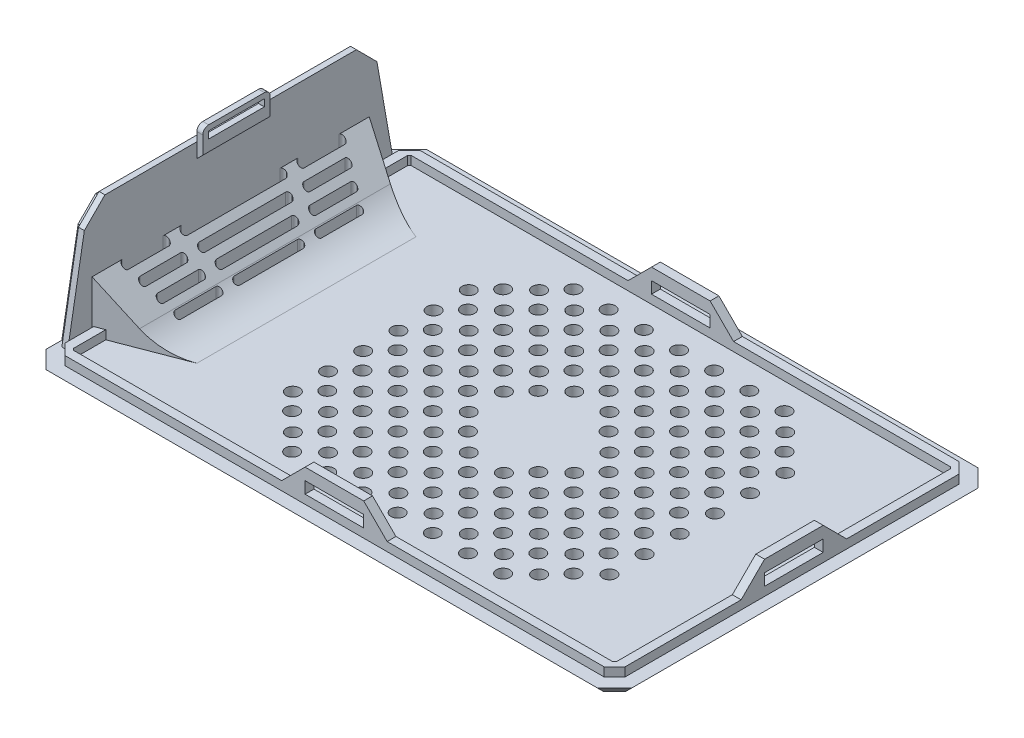
from build123d import *

# Parameters (mm, degrees)
SKETCH_1_W                = 100
SKETCH_1_H                = 65
EXTRUDE_1_DEPTH           = 2
EXTRUDE_2_DEPTH           = 2
RIB_3_REACH               = 65.494
SKETCH_7_WALL_W           = 143.931495702
SKETCH_7_WALL_H           = 40
CUT_EXTRUDE_3_DEPTH       = 18
CUT_EXTRUDE_3_DEPTH_BACK  = 18
CHAMFER_5_SIZE            = 3.646708333
CHAMFER_5_SIZE_2          = 9.5
CHAMFER_6_SIZE            = 3.646708333
CHAMFER_6_SIZE_2          = 9.5
CHAMFER_7_SIZE            = 3.83864035
CHAMFER_7_SIZE_2          = 10
CHAMFER_8_SIZE            = 3.83864035
CHAMFER_8_SIZE_2          = 10
EXTRUDE_3_DEPTH           = 1.5
SKETCH_11_W               = 1.5
SKETCH_11_H               = 10
SKETCH_11_W_2             = 10
SKETCH_11_H_2             = 1.5
EXTRUDE_4_DEPTH           = 4
CHAMFER_9_SIZE            = 4
SKETCH_12_W               = 10
SKETCH_12_H               = 2
CUT_EXTRUDE_5_DEPTH       = 84.181007448
CUT_EXTRUDE_6_REACH       = 107.339
SKETCH_13_W               = 10
SKETCH_13_H               = 2
SKETCH_14_W               = 11.5
SKETCH_14_H               = 5
EXTRUDE_5_DEPTH           = 1
CHAMFER_11_SIZE           = 1
CUT_EXTRUDE_7_REACH       = 107.146
SKETCH_15_W               = 9.5
SKETCH_15_H               = 1.2
SKETCH_16_R               = 6
EXTRUDE_6_DEPTH           = 1
CUT_EXTRUDE_11_DEPTH      = 0.5
CUT_EXTRUDE_11_DEPTH_BACK = 0.5
SKETCH_17_R               = 5
SKETCH_19_R               = 1.25
CUT_EXTRUDE_12_DEPTH      = 2
CUT_EXTRUDE_12_TAPER      = 3
CHAMFER_12_SIZE           = 3
CHAMFER_13_SIZE           = 2
FILLET_1_R                = 10
SKETCH_21_W               = 1
SKETCH_21_H               = 12
SKETCH_21_H_2             = 14
SKETCH_21_H_3             = 16
SKETCH_21_H_4             = 18
SKETCH_21_H_5             = 8
CUT_EXTRUDE_14_DEPTH      = 12
FILLET_2_R                = 0.6
FILLET_4_R                = 1
CUT_EXTRUDE_15_DEPTH      = 1
FILLET_5_R                = 0.5


# Some blends are built 0.0001 mm under size
with BuildPart() as part:
    # 草图1 → 凸台-拉伸1 (new body)
    with BuildSketch(Plane(origin=(0, 0, 0), x_dir=(1, 0, 0), z_dir=(0, 1, 0))):
        Rectangle(SKETCH_1_W, SKETCH_1_H)
    extrude(amount=EXTRUDE_1_DEPTH)

    # 草图2 → 凸台-拉伸2 (add)
    with BuildSketch(Plane.ZY.offset(50)):
        Polygon((21.45, 21.8), (24.96, 18.274540908), (27.80177009, 2), (-27.795672162, 2), (-24.960295761, 18.274540908), (-21.45, 21.8), align=None)
    extrude(amount=-EXTRUDE_2_DEPTH)

    # 草图7 wall → 筋3 (add, up to next)
    with BuildSketch(Plane(origin=(-43.769470265, 6.556687364, 0), x_dir=(0.707106781187, -0.707106781187, 0), z_dir=(0.707106781187, 0.707106781187, 0)), mode=Mode.PRIVATE) as rib_3_sk1:
        Rectangle(SKETCH_7_WALL_W, SKETCH_7_WALL_H)
    rib_3_tool1 = extrude(rib_3_sk1.sketch, amount=-RIB_3_REACH, mode=Mode.PRIVATE) - part.part
    add(rib_3_tool1.solids().sort_by_distance((-43.769470265, 6.556687364, 0))[0])

    # 草图8 → 切除-拉伸3 (cut, two sides: drawn at the far end of the back side and taken through both)
    with BuildSketch(Plane.XY.offset(-CUT_EXTRUDE_3_DEPTH_BACK)):
        Polygon((-52.858914497, 12.817704471), (-36.973570274, -3.067639752), (-52.858914497, -3.067639752), align=None)
    extrude(amount=CUT_EXTRUDE_3_DEPTH + CUT_EXTRUDE_3_DEPTH_BACK, mode=Mode.SUBTRACT)

    # 倒角5
    # the kernel refuses this chamfer: 9.5, 3.646708333 mm, written as the material it adds along each edge
    with BuildSketch(Plane(origin=(-48, 35.426470674, -20), x_dir=(0, 0, -1), z_dir=(0, -1, 0))) as chamfer_5_piece_1_section:
        Polygon((CHAMFER_5_SIZE, 0), (0, CHAMFER_5_SIZE_2), (0, 0), align=None)
    chamfer_5_piece_1 = extrude(amount=33.426470674, mode=Mode.PRIVATE)
    chamfer_5_piece_1 = split(chamfer_5_piece_1, bisect_by=Plane(origin=(-60.319626788, 23.106843887, -20), z_dir=(-0.7071067811865476, -0.7071067811865476, 0)), keep=Keep.TOP, mode=Mode.PRIVATE)
    add(chamfer_5_piece_1)

    # 倒角6
    # the kernel refuses this chamfer: 9.5, 3.646708333 mm, written as the material it adds along each edge
    with BuildSketch(Plane(origin=(-48, 2, 20), x_dir=(0, 0, 1), z_dir=(0, 1, 0))) as chamfer_6_piece_1_section:
        Polygon((CHAMFER_6_SIZE, 0), (0, CHAMFER_6_SIZE_2), (0, 0), align=None)
    chamfer_6_piece_1 = extrude(amount=33.426470674, mode=Mode.PRIVATE)
    chamfer_6_piece_1 = split(chamfer_6_piece_1, bisect_by=Plane(origin=(-43.60639145, 6.393608549, 20), z_dir=(-0.7071067811865476, -0.7071067811865476, 0)), keep=Keep.TOP, mode=Mode.PRIVATE)
    add(chamfer_6_piece_1)

    # 倒角7
    # the kernel refuses this chamfer: 10, 3.83864035 mm, written as the material it takes off along each edge
    with BuildSketch(Plane(origin=(-50, 35.894846369, 18), x_dir=(0, 0, 1), z_dir=(0, -1, 0))) as chamfer_7_piece_1_section:
        Polygon((CHAMFER_7_SIZE, 0), (0, -CHAMFER_7_SIZE_2), (0, 0), align=None)
    chamfer_7_piece_1 = extrude(amount=61.830902764, mode=Mode.PRIVATE)
    chamfer_7_piece_1 = split(chamfer_7_piece_1, bisect_by=Plane(origin=(-62.968028198, 22.926818172, 18), z_dir=(-0.7071067811865475, -0.7071067811865477, 0)), keep=Keep.TOP, mode=Mode.PRIVATE)
    add(chamfer_7_piece_1, mode=Mode.SUBTRACT)

    # 倒角8
    # the kernel refuses this chamfer: 10, 3.83864035 mm, written as the material it takes off along each edge
    with BuildSketch(Plane(origin=(-50, 35.894846369, -18), x_dir=(0, 0, -1), z_dir=(0, -1, 0))) as chamfer_8_piece_1_section:
        Polygon((CHAMFER_8_SIZE, 0), (0, CHAMFER_8_SIZE_2), (0, 0), align=None)
    chamfer_8_piece_1 = extrude(amount=61.830902764, mode=Mode.PRIVATE)
    chamfer_8_piece_1 = split(chamfer_8_piece_1, bisect_by=Plane(origin=(-62.968028198, 22.926818172, -18), z_dir=(-0.7071067811865476, -0.7071067811865476, 0)), keep=Keep.TOP, mode=Mode.PRIVATE)
    add(chamfer_8_piece_1, mode=Mode.SUBTRACT)

    # 草图10 → 凸台-拉伸3 (add)
    with BuildSketch(Plane(origin=(0, 2, 0), x_dir=(1, 0, 0), z_dir=(0, 1, 0))):
        Polygon((-46.3, -23), (-46.3, -28.5), (-46, -28.8), (46, -28.8), (46.3, -28.5), (46.3, 28.5), (46, 28.8), (-46, 28.8), (-46.3, 28.5), (-46.3, 23), (-47.8, 23), (-47.8, 28.5), (-46, 30.3), (46, 30.3), (47.8, 28.5), (47.8, -28.5), (46, -30.3), (-46, -30.3), (-47.8, -28.5), (-47.8, -23), align=None)
    extrude(amount=EXTRUDE_3_DEPTH)

    # 草图11 → 凸台-拉伸4 (add)
    with BuildSketch(Plane(origin=(0, 3.5, 0), x_dir=(1, 0, 0), z_dir=(0, 1, 0))):
        with Locations((47.05, 0.290211062)):
            Rectangle(SKETCH_11_W, SKETCH_11_H)
        with Locations((0, 29.55)):
            Rectangle(SKETCH_11_W_2, SKETCH_11_H_2)
        with Locations((0, -29.55)):
            Rectangle(SKETCH_11_W_2, SKETCH_11_H_2)
    extrude(amount=EXTRUDE_4_DEPTH)

    # 倒角9
    chamfer_9_edges = [part.edges().sort_by_distance(p)[0] for p in [
        (47.05, 3.5, -5.290211062),
        (47.05, 3.5, 4.709788938),
        (5, 3.5, 29.55),
        (-5, 3.5, 29.55),
        (-5, 3.5, -29.55),
        (5, 3.5, -29.55),
    ]]
    chamfer(chamfer_9_edges, length=CHAMFER_9_SIZE - 0.0001)  # a hair under: the kernel refuses the full size

    # 草图12 → 切除-拉伸5 (cut, through all)
    with BuildSketch(Plane.XY.offset(30.3)):
        with Locations((0, 4.5)):
            Rectangle(SKETCH_12_W, SKETCH_12_H)
    extrude(amount=-CUT_EXTRUDE_5_DEPTH, mode=Mode.SUBTRACT)

    # 草图13 → 切除-拉伸6 (cut, up to next)
    with BuildSketch(Plane(origin=(47.8, 0, 0), x_dir=(0, 0, -1), z_dir=(1, 0, 0)), mode=Mode.PRIVATE) as cut_extrude_6_sk1:
        with Locations((0.290211062, 4.5)):
            Rectangle(SKETCH_13_W, SKETCH_13_H)
    cut_extrude_6_tool1 = extrude(cut_extrude_6_sk1.sketch, amount=-CUT_EXTRUDE_6_REACH, mode=Mode.PRIVATE) & part.part
    add(cut_extrude_6_tool1.solids().sort_by_distance((47.8, 4.5, -0.290211))[0], mode=Mode.SUBTRACT)

    # 草图14 → 凸台-拉伸5 (add)
    with BuildSketch(Plane(origin=(-48, 0, 0), x_dir=(0, 0, -1), z_dir=(1, 0, 0))):
        with Locations((0, 21.8)):
            Rectangle(SKETCH_14_W, SKETCH_14_H)
    extrude(amount=EXTRUDE_5_DEPTH)

    # 倒角11
    chamfer_11_edges = [part.edges().sort_by_distance(p)[0] for p in [
        (-47, 19.3, 0),
    ]]
    chamfer(chamfer_11_edges, length=CHAMFER_11_SIZE - 0.0001)  # a hair under: the kernel refuses the full size

    # 草图15 → 切除-拉伸7 (cut, up to next)
    with BuildSketch(Plane(origin=(-47, 0, 0), x_dir=(0, 0, -1), z_dir=(1, 0, 0)), mode=Mode.PRIVATE) as cut_extrude_7_sk1:
        with Locations((0, 22.8)):
            Rectangle(SKETCH_15_W, SKETCH_15_H)
    cut_extrude_7_tool1 = extrude(cut_extrude_7_sk1.sketch, amount=-CUT_EXTRUDE_7_REACH, mode=Mode.PRIVATE) & part.part
    add(cut_extrude_7_tool1.solids().sort_by_distance((-47, 22.8, 0))[0], mode=Mode.SUBTRACT)

    # 草图16 → 凸台-拉伸6 (add)
    with BuildSketch(Plane.XZ):
        with Locations(Location((40, 22.5, 0), (0, 0, 90))):
            Circle(SKETCH_16_R)
        with Locations(Location((40, -22.5, 0), (0, 0, 90))):
            Circle(SKETCH_16_R)
        with Locations(Location((-32, 22.5, 0), (0, 0, 90))):
            Circle(SKETCH_16_R)
        with Locations(Location((-32, -22.5, 0), (0, 0, 90))):
            Circle(SKETCH_16_R)
    extrude(amount=EXTRUDE_6_DEPTH)

    # 草图17 → 切除-拉伸11 (cut, two sides: drawn at the far end of the back side and taken through both)
    with BuildSketch(Plane(origin=(0, -1, 0), x_dir=(-1, 0, 0), z_dir=(0, -1, 0)).offset(-CUT_EXTRUDE_11_DEPTH_BACK)):
        with Locations(Location((-40, -22.5, 0), (0, 0, 90))):
            Circle(SKETCH_17_R)
        with Locations(Location((-40, 22.5, 0), (0, 0, 90))):
            Circle(SKETCH_17_R)
        with Locations(Location((32, -22.5, 0), (0, 0, 90))):
            Circle(SKETCH_17_R)
        with Locations(Location((32, 22.5, 0), (0, 0, 90))):
            Circle(SKETCH_17_R)
    extrude(amount=CUT_EXTRUDE_11_DEPTH + CUT_EXTRUDE_11_DEPTH_BACK, mode=Mode.SUBTRACT)

    # 草图19 → 切除-拉伸12 (cut)
    with BuildSketch(Plane(origin=(0, 0, 0), x_dir=(-1, 0, 0), z_dir=(0, -1, 0))):
        with Locations((16.686897547, 21.304584658)):
            Circle(SKETCH_19_R)
        with Locations((10.686897547, 21.304584658)):
            Circle(SKETCH_19_R)
        with Locations((4.686897547, 21.304584658)):
            Circle(SKETCH_19_R)
        with Locations((-1.313102453, 21.304584658)):
            Circle(SKETCH_19_R)
        with Locations((-7.313102453, 21.304584658)):
            Circle(SKETCH_19_R)
        with Locations((-13.313102453, 21.304584658)):
            Circle(SKETCH_19_R)
        with Locations((-19.313102453, 21.304584658)):
            Circle(SKETCH_19_R)
        with Locations((-25.313102453, 21.304584658)):
            Circle(SKETCH_19_R)
        with Locations((16.686897547, 15.304584658)):
            Circle(SKETCH_19_R)
        with Locations((10.686897547, 15.304584658)):
            Circle(SKETCH_19_R)
        with Locations((4.686897547, 15.304584658)):
            Circle(SKETCH_19_R)
        with Locations((-1.313102453, 15.304584658)):
            Circle(SKETCH_19_R)
        with Locations((-7.313102453, 15.304584658)):
            Circle(SKETCH_19_R)
        with Locations((-13.313102453, 15.304584658)):
            Circle(SKETCH_19_R)
        with Locations((-19.313102453, 15.304584658)):
            Circle(SKETCH_19_R)
        with Locations((-25.313102453, 15.304584658)):
            Circle(SKETCH_19_R)
        with Locations((-31.313102453, 15.304584658)):
            Circle(SKETCH_19_R)
        with Locations((16.686897547, 9.304584658)):
            Circle(SKETCH_19_R)
        with Locations((10.686897547, 9.304584658)):
            Circle(SKETCH_19_R)
        with Locations((4.686897547, 9.304584658)):
            Circle(SKETCH_19_R)
        with Locations((-1.313102453, 9.304584658)):
            Circle(SKETCH_19_R)
        with Locations((-7.313102453, 9.304584658)):
            Circle(SKETCH_19_R)
        with Locations((-13.313102453, 9.304584658)):
            Circle(SKETCH_19_R)
        with Locations((-19.313102453, 9.304584658)):
            Circle(SKETCH_19_R)
        with Locations((-25.313102453, 9.304584658)):
            Circle(SKETCH_19_R)
        with Locations((-31.313102453, 9.304584658)):
            Circle(SKETCH_19_R)
        with Locations((16.686897547, 3.304584658)):
            Circle(SKETCH_19_R)
        with Locations((10.686897547, 3.304584658)):
            Circle(SKETCH_19_R)
        with Locations((4.686897547, 3.304584658)):
            Circle(SKETCH_19_R)
        with Locations((-13.313102453, 3.304584658)):
            Circle(SKETCH_19_R)
        with Locations((-19.313102453, 3.304584658)):
            Circle(SKETCH_19_R)
        with Locations((-25.313102453, 3.304584658)):
            Circle(SKETCH_19_R)
        with Locations((-31.313102453, 3.304584658)):
            Circle(SKETCH_19_R)
        with Locations((16.686897547, -2.695415342)):
            Circle(SKETCH_19_R)
        with Locations((10.686897547, -2.695415342)):
            Circle(SKETCH_19_R)
        with Locations((4.686897547, -2.695415342)):
            Circle(SKETCH_19_R)
        with Locations((-13.313102453, -2.695415342)):
            Circle(SKETCH_19_R)
        with Locations((-19.313102453, -2.695415342)):
            Circle(SKETCH_19_R)
        with Locations((-25.313102453, -2.695415342)):
            Circle(SKETCH_19_R)
        with Locations((-31.313102453, -2.695415342)):
            Circle(SKETCH_19_R)
        with Locations((16.686897547, -8.695415342)):
            Circle(SKETCH_19_R)
        with Locations((10.686897547, -8.695415342)):
            Circle(SKETCH_19_R)
        with Locations((4.686897547, -8.695415342)):
            Circle(SKETCH_19_R)
        with Locations((-1.313102453, -8.695415342)):
            Circle(SKETCH_19_R)
        with Locations((-7.313102453, -8.695415342)):
            Circle(SKETCH_19_R)
        with Locations((-13.313102453, -8.695415342)):
            Circle(SKETCH_19_R)
        with Locations((-19.313102453, -8.695415342)):
            Circle(SKETCH_19_R)
        with Locations((-25.313102453, -8.695415342)):
            Circle(SKETCH_19_R)
        with Locations((-31.313102453, -8.695415342)):
            Circle(SKETCH_19_R)
        with Locations((16.686897547, -14.695415342)):
            Circle(SKETCH_19_R)
        with Locations((10.686897547, -14.695415342)):
            Circle(SKETCH_19_R)
        with Locations((4.686897547, -14.695415342)):
            Circle(SKETCH_19_R)
        with Locations((-1.313102453, -14.695415342)):
            Circle(SKETCH_19_R)
        with Locations((-7.313102453, -14.695415342)):
            Circle(SKETCH_19_R)
        with Locations((-13.313102453, -14.695415342)):
            Circle(SKETCH_19_R)
        with Locations((-19.313102453, -14.695415342)):
            Circle(SKETCH_19_R)
        with Locations((-25.313102453, -14.695415342)):
            Circle(SKETCH_19_R)
        with Locations((-31.313102453, -14.695415342)):
            Circle(SKETCH_19_R)
        with Locations((16.686897547, -20.695415342)):
            Circle(SKETCH_19_R)
        with Locations((10.686897547, -20.695415342)):
            Circle(SKETCH_19_R)
        with Locations((4.686897547, -20.695415342)):
            Circle(SKETCH_19_R)
        with Locations((-1.313102453, -20.695415342)):
            Circle(SKETCH_19_R)
        with Locations((-7.313102453, -20.695415342)):
            Circle(SKETCH_19_R)
        with Locations((-13.313102453, -20.695415342)):
            Circle(SKETCH_19_R)
        with Locations((-19.313102453, -20.695415342)):
            Circle(SKETCH_19_R)
        with Locations((-25.313102453, -20.695415342)):
            Circle(SKETCH_19_R)
        with Locations((22.686897547, 15.304584658)):
            Circle(SKETCH_19_R)
        with Locations((22.686897547, 9.304584658)):
            Circle(SKETCH_19_R)
        with Locations((22.686897547, 3.304584658)):
            Circle(SKETCH_19_R)
        with Locations((22.686897547, -2.695415342)):
            Circle(SKETCH_19_R)
        with Locations((22.686897547, -8.695415342)):
            Circle(SKETCH_19_R)
        with Locations((22.686897547, -14.695415342)):
            Circle(SKETCH_19_R)
        with Locations((13.876131479, 24.359972587)):
            Circle(SKETCH_19_R)
        with Locations((7.876131479, 24.359972587)):
            Circle(SKETCH_19_R)
        with Locations((1.876131479, 24.359972587)):
            Circle(SKETCH_19_R)
        with Locations((-4.123868521, 24.359972587)):
            Circle(SKETCH_19_R)
        with Locations((-10.123868521, 24.359972587)):
            Circle(SKETCH_19_R)
        with Locations((-16.123868521, 24.359972587)):
            Circle(SKETCH_19_R)
        with Locations((-22.123868521, 24.359972587)):
            Circle(SKETCH_19_R)
        with Locations((13.876131479, 18.359972587)):
            Circle(SKETCH_19_R)
        with Locations((7.876131479, 18.359972587)):
            Circle(SKETCH_19_R)
        with Locations((1.876131479, 18.359972587)):
            Circle(SKETCH_19_R)
        with Locations((-4.123868521, 18.359972587)):
            Circle(SKETCH_19_R)
        with Locations((-10.123868521, 18.359972587)):
            Circle(SKETCH_19_R)
        with Locations((-16.123868521, 18.359972587)):
            Circle(SKETCH_19_R)
        with Locations((-22.123868521, 18.359972587)):
            Circle(SKETCH_19_R)
        with Locations((-28.123868521, 18.359972587)):
            Circle(SKETCH_19_R)
        with Locations((13.876131479, 12.359972587)):
            Circle(SKETCH_19_R)
        with Locations((7.876131479, 12.359972587)):
            Circle(SKETCH_19_R)
        with Locations((1.876131479, 12.359972587)):
            Circle(SKETCH_19_R)
        with Locations((-4.123868521, 12.359972587)):
            Circle(SKETCH_19_R)
        with Locations((-10.123868521, 12.359972587)):
            Circle(SKETCH_19_R)
        with Locations((-16.123868521, 12.359972587)):
            Circle(SKETCH_19_R)
        with Locations((-22.123868521, 12.359972587)):
            Circle(SKETCH_19_R)
        with Locations((-28.123868521, 12.359972587)):
            Circle(SKETCH_19_R)
        with Locations((13.876131479, 6.359972587)):
            Circle(SKETCH_19_R)
        with Locations((7.876131479, 6.359972587)):
            Circle(SKETCH_19_R)
        with Locations((1.876131479, 6.359972587)):
            Circle(SKETCH_19_R)
        with Locations((-10.123868521, 6.359972587)):
            Circle(SKETCH_19_R)
        with Locations((-16.123868521, 6.359972587)):
            Circle(SKETCH_19_R)
        with Locations((-22.123868521, 6.359972587)):
            Circle(SKETCH_19_R)
        with Locations((-28.123868521, 6.359972587)):
            Circle(SKETCH_19_R)
        with Locations((13.876131479, 0.359972587)):
            Circle(SKETCH_19_R)
        with Locations((7.876131479, 0.359972587)):
            Circle(SKETCH_19_R)
        with Locations((-16.123868521, 0.359972587)):
            Circle(SKETCH_19_R)
        with Locations((-22.123868521, 0.359972587)):
            Circle(SKETCH_19_R)
        with Locations((-28.123868521, 0.359972587)):
            Circle(SKETCH_19_R)
        with Locations((13.876131479, -5.640027413)):
            Circle(SKETCH_19_R)
        with Locations((7.876131479, -5.640027413)):
            Circle(SKETCH_19_R)
        with Locations((1.876131479, -5.640027413)):
            Circle(SKETCH_19_R)
        with Locations((-10.123868521, -5.640027413)):
            Circle(SKETCH_19_R)
        with Locations((-16.123868521, -5.640027413)):
            Circle(SKETCH_19_R)
        with Locations((-22.123868521, -5.640027413)):
            Circle(SKETCH_19_R)
        with Locations((-28.123868521, -5.640027413)):
            Circle(SKETCH_19_R)
        with Locations((13.876131479, -11.640027413)):
            Circle(SKETCH_19_R)
        with Locations((7.876131479, -11.640027413)):
            Circle(SKETCH_19_R)
        with Locations((1.876131479, -11.640027413)):
            Circle(SKETCH_19_R)
        with Locations((-4.123868521, -11.640027413)):
            Circle(SKETCH_19_R)
        with Locations((-10.123868521, -11.640027413)):
            Circle(SKETCH_19_R)
        with Locations((-16.123868521, -11.640027413)):
            Circle(SKETCH_19_R)
        with Locations((-22.123868521, -11.640027413)):
            Circle(SKETCH_19_R)
        with Locations((-28.123868521, -11.640027413)):
            Circle(SKETCH_19_R)
        with Locations((13.876131479, -17.640027413)):
            Circle(SKETCH_19_R)
        with Locations((7.876131479, -17.640027413)):
            Circle(SKETCH_19_R)
        with Locations((1.876131479, -17.640027413)):
            Circle(SKETCH_19_R)
        with Locations((-4.123868521, -17.640027413)):
            Circle(SKETCH_19_R)
        with Locations((-10.123868521, -17.640027413)):
            Circle(SKETCH_19_R)
        with Locations((-16.123868521, -17.640027413)):
            Circle(SKETCH_19_R)
        with Locations((-22.123868521, -17.640027413)):
            Circle(SKETCH_19_R)
        with Locations((-28.123868521, -17.640027413)):
            Circle(SKETCH_19_R)
        with Locations((13.876131479, -23.640027413)):
            Circle(SKETCH_19_R)
        with Locations((7.876131479, -23.640027413)):
            Circle(SKETCH_19_R)
        with Locations((1.876131479, -23.640027413)):
            Circle(SKETCH_19_R)
        with Locations((-4.123868521, -23.640027413)):
            Circle(SKETCH_19_R)
        with Locations((-10.123868521, -23.640027413)):
            Circle(SKETCH_19_R)
        with Locations((-16.123868521, -23.640027413)):
            Circle(SKETCH_19_R)
        with Locations((-22.123868521, -23.640027413)):
            Circle(SKETCH_19_R)
        with Locations((19.876131479, 18.359972587)):
            Circle(SKETCH_19_R)
        with Locations((19.876131479, 12.359972587)):
            Circle(SKETCH_19_R)
        with Locations((19.876131479, 6.359972587)):
            Circle(SKETCH_19_R)
        with Locations((19.876131479, 0.359972587)):
            Circle(SKETCH_19_R)
        with Locations((19.876131479, -5.640027413)):
            Circle(SKETCH_19_R)
        with Locations((19.876131479, -11.640027413)):
            Circle(SKETCH_19_R)
        with Locations((19.876131479, -17.640027413)):
            Circle(SKETCH_19_R)
    extrude(amount=-CUT_EXTRUDE_12_DEPTH, taper=CUT_EXTRUDE_12_TAPER, mode=Mode.SUBTRACT)

    # 倒角12
    chamfer_12_edges = [part.edges().sort_by_distance(p)[0] for p in [
        (50, 1, 32.5),
        (-50, 1, 32.5),
        (-50, 1, -32.5),
        (50, 1, -32.5),
    ]]
    chamfer(chamfer_12_edges, length=CHAMFER_12_SIZE)

    # 倒角13
    chamfer_13_edges = [part.edges().sort_by_distance(p)[0] for p in [
        (-45.020605013, 0, 19.927229698),
        (-50, 0, 25.669320175),
        (-48.5, 0, 31),
        (0, 0, 32.5),
        (48.5, 0, 31),
        (50, 0, 0),
        (48.5, 0, -31),
        (0, 0, -32.5),
        (-48.5, 0, -31),
        (-45.020605013, 0, -19.927229698),
        (-50, 0, -25.669320175),
    ]]
    chamfer(chamfer_13_edges, length=CHAMFER_13_SIZE - 0.0001)  # a hair under: the kernel refuses the full size

    # 圆角1
    fillet_1_edges = [part.edges().sort_by_distance(p)[0] for p in [
        (-39.212782901, 2, 0),
    ]]
    fillet(fillet_1_edges, radius=FILLET_1_R)

    # 草图21 → 切除-拉伸14 (cut)
    with BuildSketch(Plane.XZ):
        with Locations((-41.5, 0)):
            Rectangle(SKETCH_21_W, SKETCH_21_H)
        with Locations((-43.5, 0)):
            Rectangle(SKETCH_21_W, SKETCH_21_H_2)
        with Locations((-45.5, 0)):
            Rectangle(SKETCH_21_W, SKETCH_21_H_3)
        with Locations((-47.5, 0)):
            Rectangle(SKETCH_21_W, SKETCH_21_H_4)
        with Locations((-47.5, 15)):
            Rectangle(SKETCH_21_W, SKETCH_21_H_5)
        with Locations((-45.5, 14)):
            Rectangle(SKETCH_21_W, SKETCH_21_H_5)
        with Locations((-43.5, 13)):
            Rectangle(SKETCH_21_W, SKETCH_21_H_5)
        with Locations((-41.5, 12)):
            Rectangle(SKETCH_21_W, SKETCH_21_H_5)
        with Locations((-41.5, -12)):
            Rectangle(SKETCH_21_W, SKETCH_21_H_5)
        with Locations((-43.5, -13)):
            Rectangle(SKETCH_21_W, SKETCH_21_H_5)
        with Locations((-45.5, -14)):
            Rectangle(SKETCH_21_W, SKETCH_21_H_5)
        with Locations((-47.5, -15)):
            Rectangle(SKETCH_21_W, SKETCH_21_H_5)
    extrude(amount=-CUT_EXTRUDE_14_DEPTH, mode=Mode.SUBTRACT)

    # 圆角2
    # the kernel refuses this fillet: 0.6 mm, written as the material it adds along each edge
    with BuildSketch(Plane(origin=(-48, 6.458789974, 9), x_dir=(0, 0, -1), z_dir=(0, 1, 0))) as fillet_2_piece_1_section:
        with BuildLine():
            CenterArc((FILLET_2_R, -FILLET_2_R), FILLET_2_R, 90, 90)
            Line((0, -FILLET_2_R), (0, 0))
            Line((0, 0), (FILLET_2_R, 0))
        make_face()
    fillet_2_piece_1 = extrude(amount=5.828427125, mode=Mode.PRIVATE)
    fillet_2_piece_1 = split(fillet_2_piece_1, bisect_by=Plane(origin=(-45.835786438, 8.623003537, 9), z_dir=(-0.7071067811865476, -0.7071067811865476, 0)), keep=Keep.TOP, mode=Mode.PRIVATE)
    fillet_2_piece_1 = split(fillet_2_piece_1, bisect_by=Plane(origin=(-47.25, 7.208789974, 9), z_dir=(0.7071067811865476, 0.7071067811865476, 0)), keep=Keep.TOP, mode=Mode.PRIVATE)
    with BuildSketch(Plane(origin=(-47, 5.458789974, 9), x_dir=(0, 0, -1), z_dir=(0, 1, 0))) as fillet_2_piece_2_section:
        with BuildLine():
            CenterArc((FILLET_2_R, FILLET_2_R), FILLET_2_R, 180, 90)
            Line((0, FILLET_2_R), (0, 0))
            Line((0, 0), (FILLET_2_R, 0))
        make_face()
    fillet_2_piece_2 = extrude(amount=5.828427125, mode=Mode.PRIVATE)
    fillet_2_piece_2 = split(fillet_2_piece_2, bisect_by=Plane(origin=(-44.835786438, 7.623003537, 9), z_dir=(-0.7071067811865476, -0.7071067811865476, 0)), keep=Keep.TOP, mode=Mode.PRIVATE)
    fillet_2_piece_2 = split(fillet_2_piece_2, bisect_by=Plane(origin=(-46.25, 6.208789974, 9), z_dir=(0.7071067811865476, 0.7071067811865476, 0)), keep=Keep.TOP, mode=Mode.PRIVATE)
    with BuildSketch(Plane(origin=(-45, 3.458789974, 8), x_dir=(0, 0, -1), z_dir=(0, 1, 0))) as fillet_2_piece_3_section:
        with BuildLine():
            CenterArc((FILLET_2_R, FILLET_2_R), FILLET_2_R, 180, 90)
            Line((0, FILLET_2_R), (0, 0))
            Line((0, 0), (FILLET_2_R, 0))
        make_face()
    fillet_2_piece_3 = extrude(amount=5.828427125, mode=Mode.PRIVATE)
    fillet_2_piece_3 = split(fillet_2_piece_3, bisect_by=Plane(origin=(-42.835786438, 5.623003537, 8), z_dir=(-0.7071067811865476, -0.7071067811865476, 0)), keep=Keep.TOP, mode=Mode.PRIVATE)
    fillet_2_piece_3 = split(fillet_2_piece_3, bisect_by=Plane(origin=(-44.25, 4.208789974, 8), z_dir=(0.7071067811865476, 0.7071067811865476, 0)), keep=Keep.TOP, mode=Mode.PRIVATE)
    with BuildSketch(Plane(origin=(-46, 4.458789974, 8), x_dir=(1, 0, 0), z_dir=(0, 1, 0))) as fillet_2_piece_4_section:
        with BuildLine():
            CenterArc((FILLET_2_R, FILLET_2_R), FILLET_2_R, 180, 90)
            Line((0, FILLET_2_R), (0, 0))
            Line((0, 0), (FILLET_2_R, 0))
        make_face()
    fillet_2_piece_4 = extrude(amount=5.828427125, mode=Mode.PRIVATE)
    fillet_2_piece_4 = split(fillet_2_piece_4, bisect_by=Plane(origin=(-43.835786438, 6.623003537, 8), z_dir=(-0.7071067811865476, -0.7071067811865476, 0)), keep=Keep.TOP, mode=Mode.PRIVATE)
    fillet_2_piece_4 = split(fillet_2_piece_4, bisect_by=Plane(origin=(-45.25, 5.208789974, 8), z_dir=(0.7071067811865476, 0.7071067811865476, 0)), keep=Keep.TOP, mode=Mode.PRIVATE)
    with BuildSketch(Plane(origin=(-44, 2.458789974, 7), x_dir=(1, 0, 0), z_dir=(0, 1, 0))) as fillet_2_piece_5_section:
        with BuildLine():
            CenterArc((FILLET_2_R, FILLET_2_R), FILLET_2_R, 180, 90)
            Line((0, FILLET_2_R), (0, 0))
            Line((0, 0), (FILLET_2_R, 0))
        make_face()
    fillet_2_piece_5 = extrude(amount=5.828427125, mode=Mode.PRIVATE)
    fillet_2_piece_5 = split(fillet_2_piece_5, bisect_by=Plane(origin=(-41.835786438, 4.623003537, 7), z_dir=(-0.7071067811865476, -0.7071067811865476, 0)), keep=Keep.TOP, mode=Mode.PRIVATE)
    fillet_2_piece_5 = split(fillet_2_piece_5, bisect_by=Plane(origin=(-43.25, 3.208789974, 7), z_dir=(0.7071067811865476, 0.7071067811865476, 0)), keep=Keep.TOP, mode=Mode.PRIVATE)
    with BuildSketch(Plane(origin=(-43, 1.458789974, 7), x_dir=(0, 0, -1), z_dir=(0, 1, 0))) as fillet_2_piece_6_section:
        with BuildLine():
            CenterArc((FILLET_2_R, FILLET_2_R), FILLET_2_R, 180, 90)
            Line((0, FILLET_2_R), (0, 0))
            Line((0, 0), (FILLET_2_R, 0))
        make_face()
    fillet_2_piece_6 = extrude(amount=5.828427125, mode=Mode.PRIVATE)
    fillet_2_piece_6 = split(fillet_2_piece_6, bisect_by=Plane(origin=(-40.835786438, 3.623003537, 7), z_dir=(-0.7071067811865476, -0.7071067811865476, 0)), keep=Keep.TOP, mode=Mode.PRIVATE)
    fillet_2_piece_6 = split(fillet_2_piece_6, bisect_by=Plane(origin=(-42.25, 2.208789974, 7), z_dir=(0.7071067811865476, 0.7071067811865476, 0)), keep=Keep.TOP, mode=Mode.PRIVATE)
    with BuildSketch(Plane(origin=(-42, 0.458789974, 6), x_dir=(0, 0, -1), z_dir=(0, 1, 0))) as fillet_2_piece_7_section:
        with BuildLine():
            CenterArc((FILLET_2_R, -FILLET_2_R), FILLET_2_R, 90, 90)
            Line((0, -FILLET_2_R), (0, 0))
            Line((0, 0), (FILLET_2_R, 0))
        make_face()
    fillet_2_piece_7 = extrude(amount=5.831212048, mode=Mode.PRIVATE)
    fillet_2_piece_7 = fillet_2_piece_7 - Plane(origin=(-35.070647277, 12, 6), x_dir=(0, -1, 0), z_dir=(0, 0, 1)) * Cylinder(10, 15, mode=Mode.PRIVATE)
    fillet_2_piece_7 = split(fillet_2_piece_7, bisect_by=Plane(origin=(-41.25, 1.208789974, 6), z_dir=(0.7071067811865476, 0.7071067811865476, 0)), keep=Keep.TOP, mode=Mode.PRIVATE)
    with BuildSketch(Plane(origin=(-41, -0.541210026, 6), x_dir=(-1, 0, 0), z_dir=(0, 1, 0))) as fillet_2_piece_8_section:
        with BuildLine():
            CenterArc((FILLET_2_R, -FILLET_2_R), FILLET_2_R, 90, 90)
            Line((0, -FILLET_2_R), (0, 0))
            Line((0, 0), (FILLET_2_R, 0))
        make_face()
    fillet_2_piece_8 = extrude(amount=5.988708782, mode=Mode.PRIVATE)
    fillet_2_piece_8 = fillet_2_piece_8 - Plane(origin=(-35.070647277, 12, 6), x_dir=(0, -1, 0), z_dir=(0, 0, 1)) * Cylinder(10, 15, mode=Mode.PRIVATE)
    fillet_2_piece_8 = split(fillet_2_piece_8, bisect_by=Plane(origin=(-40.25, 0.208789974, 6), z_dir=(0.7071067811865476, 0.7071067811865476, 0)), keep=Keep.TOP, mode=Mode.PRIVATE)
    with BuildSketch(Plane(origin=(-48, 6.458789974, -9), x_dir=(0, 0, 1), z_dir=(0, 1, 0))) as fillet_2_piece_9_section:
        with BuildLine():
            CenterArc((FILLET_2_R, FILLET_2_R), FILLET_2_R, 180, 90)
            Line((0, FILLET_2_R), (0, 0))
            Line((0, 0), (FILLET_2_R, 0))
        make_face()
    fillet_2_piece_9 = extrude(amount=5.828427125, mode=Mode.PRIVATE)
    fillet_2_piece_9 = split(fillet_2_piece_9, bisect_by=Plane(origin=(-45.835786438, 8.623003537, -9), z_dir=(-0.7071067811865476, -0.7071067811865476, 0)), keep=Keep.TOP, mode=Mode.PRIVATE)
    fillet_2_piece_9 = split(fillet_2_piece_9, bisect_by=Plane(origin=(-47.25, 7.208789974, -9), z_dir=(0.7071067811865476, 0.7071067811865476, 0)), keep=Keep.TOP, mode=Mode.PRIVATE)
    with BuildSketch(Plane(origin=(-47, 5.458789974, -9), x_dir=(-1, 0, 0), z_dir=(0, 1, 0))) as fillet_2_piece_10_section:
        with BuildLine():
            CenterArc((FILLET_2_R, FILLET_2_R), FILLET_2_R, 180, 90)
            Line((0, FILLET_2_R), (0, 0))
            Line((0, 0), (FILLET_2_R, 0))
        make_face()
    fillet_2_piece_10 = extrude(amount=5.828427125, mode=Mode.PRIVATE)
    fillet_2_piece_10 = split(fillet_2_piece_10, bisect_by=Plane(origin=(-44.835786438, 7.623003537, -9), z_dir=(-0.7071067811865476, -0.7071067811865476, 0)), keep=Keep.TOP, mode=Mode.PRIVATE)
    fillet_2_piece_10 = split(fillet_2_piece_10, bisect_by=Plane(origin=(-46.25, 6.208789974, -9), z_dir=(0.7071067811865476, 0.7071067811865476, 0)), keep=Keep.TOP, mode=Mode.PRIVATE)
    with BuildSketch(Plane(origin=(-46, 4.458789974, -8), x_dir=(1, 0, 0), z_dir=(0, 1, 0))) as fillet_2_piece_11_section:
        with BuildLine():
            CenterArc((FILLET_2_R, -FILLET_2_R), FILLET_2_R, 90, 90)
            Line((0, -FILLET_2_R), (0, 0))
            Line((0, 0), (FILLET_2_R, 0))
        make_face()
    fillet_2_piece_11 = extrude(amount=5.828427125, mode=Mode.PRIVATE)
    fillet_2_piece_11 = split(fillet_2_piece_11, bisect_by=Plane(origin=(-43.835786438, 6.623003537, -8), z_dir=(-0.7071067811865476, -0.7071067811865476, 0)), keep=Keep.TOP, mode=Mode.PRIVATE)
    fillet_2_piece_11 = split(fillet_2_piece_11, bisect_by=Plane(origin=(-45.25, 5.208789974, -8), z_dir=(0.7071067811865476, 0.7071067811865476, 0)), keep=Keep.TOP, mode=Mode.PRIVATE)
    with BuildSketch(Plane(origin=(-45, 3.458789974, -8), x_dir=(-1, 0, 0), z_dir=(0, 1, 0))) as fillet_2_piece_12_section:
        with BuildLine():
            CenterArc((FILLET_2_R, FILLET_2_R), FILLET_2_R, 180, 90)
            Line((0, FILLET_2_R), (0, 0))
            Line((0, 0), (FILLET_2_R, 0))
        make_face()
    fillet_2_piece_12 = extrude(amount=5.828427125, mode=Mode.PRIVATE)
    fillet_2_piece_12 = split(fillet_2_piece_12, bisect_by=Plane(origin=(-42.835786438, 5.623003537, -8), z_dir=(-0.7071067811865476, -0.7071067811865476, 0)), keep=Keep.TOP, mode=Mode.PRIVATE)
    fillet_2_piece_12 = split(fillet_2_piece_12, bisect_by=Plane(origin=(-44.25, 4.208789974, -8), z_dir=(0.7071067811865476, 0.7071067811865476, 0)), keep=Keep.TOP, mode=Mode.PRIVATE)
    with BuildSketch(Plane(origin=(-44, 2.458789974, -7), x_dir=(1, 0, 0), z_dir=(0, 1, 0))) as fillet_2_piece_13_section:
        with BuildLine():
            CenterArc((FILLET_2_R, -FILLET_2_R), FILLET_2_R, 90, 90)
            Line((0, -FILLET_2_R), (0, 0))
            Line((0, 0), (FILLET_2_R, 0))
        make_face()
    fillet_2_piece_13 = extrude(amount=5.828427125, mode=Mode.PRIVATE)
    fillet_2_piece_13 = split(fillet_2_piece_13, bisect_by=Plane(origin=(-41.835786438, 4.623003537, -7), z_dir=(-0.7071067811865476, -0.7071067811865476, 0)), keep=Keep.TOP, mode=Mode.PRIVATE)
    fillet_2_piece_13 = split(fillet_2_piece_13, bisect_by=Plane(origin=(-43.25, 3.208789974, -7), z_dir=(0.7071067811865476, 0.7071067811865476, 0)), keep=Keep.TOP, mode=Mode.PRIVATE)
    with BuildSketch(Plane(origin=(-43, 1.458789974, -7), x_dir=(-1, 0, 0), z_dir=(0, 1, 0))) as fillet_2_piece_14_section:
        with BuildLine():
            CenterArc((FILLET_2_R, FILLET_2_R), FILLET_2_R, 180, 90)
            Line((0, FILLET_2_R), (0, 0))
            Line((0, 0), (FILLET_2_R, 0))
        make_face()
    fillet_2_piece_14 = extrude(amount=5.828427125, mode=Mode.PRIVATE)
    fillet_2_piece_14 = split(fillet_2_piece_14, bisect_by=Plane(origin=(-40.835786438, 3.623003537, -7), z_dir=(-0.7071067811865476, -0.7071067811865476, 0)), keep=Keep.TOP, mode=Mode.PRIVATE)
    fillet_2_piece_14 = split(fillet_2_piece_14, bisect_by=Plane(origin=(-42.25, 2.208789974, -7), z_dir=(0.7071067811865476, 0.7071067811865476, 0)), keep=Keep.TOP, mode=Mode.PRIVATE)
    with BuildSketch(Plane(origin=(-42, 0.458789974, -6), x_dir=(0, 0, 1), z_dir=(0, 1, 0))) as fillet_2_piece_15_section:
        with BuildLine():
            CenterArc((FILLET_2_R, FILLET_2_R), FILLET_2_R, 180, 90)
            Line((0, FILLET_2_R), (0, 0))
            Line((0, 0), (FILLET_2_R, 0))
        make_face()
    fillet_2_piece_15 = extrude(amount=5.831212048, mode=Mode.PRIVATE)
    fillet_2_piece_15 = fillet_2_piece_15 - Plane(origin=(-35.070647277, 12, -6), x_dir=(0, -1, 0), z_dir=(0, 0, 1)) * Cylinder(10, 15, mode=Mode.PRIVATE)
    fillet_2_piece_15 = split(fillet_2_piece_15, bisect_by=Plane(origin=(-41.25, 1.208789974, -6), z_dir=(0.7071067811865476, 0.7071067811865476, 0)), keep=Keep.TOP, mode=Mode.PRIVATE)
    with BuildSketch(Plane(origin=(-41, -0.541210026, -6), x_dir=(0, 0, 1), z_dir=(0, 1, 0))) as fillet_2_piece_16_section:
        with BuildLine():
            CenterArc((FILLET_2_R, -FILLET_2_R), FILLET_2_R, 90, 90)
            Line((0, -FILLET_2_R), (0, 0))
            Line((0, 0), (FILLET_2_R, 0))
        make_face()
    fillet_2_piece_16 = extrude(amount=5.988708782, mode=Mode.PRIVATE)
    fillet_2_piece_16 = fillet_2_piece_16 - Plane(origin=(-35.070647277, 12, -6), x_dir=(0, -1, 0), z_dir=(0, 0, 1)) * Cylinder(10, 15, mode=Mode.PRIVATE)
    fillet_2_piece_16 = split(fillet_2_piece_16, bisect_by=Plane(origin=(-40.25, 0.208789974, -6), z_dir=(0.7071067811865476, 0.7071067811865476, 0)), keep=Keep.TOP, mode=Mode.PRIVATE)
    add([fillet_2_piece_1, fillet_2_piece_2, fillet_2_piece_3, fillet_2_piece_4, fillet_2_piece_5, fillet_2_piece_6, fillet_2_piece_7, fillet_2_piece_8, fillet_2_piece_9, fillet_2_piece_10, fillet_2_piece_11, fillet_2_piece_12, fillet_2_piece_13, fillet_2_piece_14, fillet_2_piece_15, fillet_2_piece_16])

    # 圆角4
    fillet_4_edges = [part.edges().sort_by_distance(p)[0] for p in [
        (-47.5, 24.3, -5.75),
        (-47.5, 24.3, 5.75),
    ]]
    fillet(fillet_4_edges, radius=FILLET_4_R)

    # 草图22 → 切除-拉伸15 (cut)
    with BuildSketch(Plane.ZY.offset(50)):
        Polygon((26.804091146, 2), (29.7, 2), (29.7, 34.2), (-29.7, 34.2), (-29.7, 2), (-26.777810676, 2), (-24.029229931, 17.78195605), (-21.034523399, 20.789598736), (21.034498698, 20.789598736), (24.029077444, 17.781830967), align=None)
    extrude(amount=-CUT_EXTRUDE_15_DEPTH, mode=Mode.SUBTRACT)

    # 圆角5
    fillet_5_edges = [part.edges().sort_by_distance(p)[0] for p in [
        (-43, 4.373003537, 9),
        (-45, 6.373003537, 10),
        (-47, 8.373003537, 11),
        (-48, 9.373003537, 11),
        (-46, 7.373003537, 10),
        (-44, 5.373003537, 9),
        (-42, 3.374395998, 8),
        (-41, 2.453144365, 8),
        (-41, 2.453144365, 16),
        (-42, 3.374395998, 16),
        (-44, 5.373003537, 17),
        (-43, 4.373003537, 17),
        (-46, 7.373003537, 18),
        (-45, 6.373003537, 18),
        (-48, 9.373003537, 19),
        (-47, 8.373003537, 19),
        (-42, 3.374395998, -8),
        (-41, 2.453144365, -8),
        (-41, 2.453144365, -16),
        (-42, 3.374395998, -16),
        (-44, 5.373003537, -17),
        (-43, 4.373003537, -17),
        (-44, 5.373003537, -9),
        (-43, 4.373003537, -9),
        (-46, 7.373003537, -10),
        (-45, 6.373003537, -10),
        (-46, 7.373003537, -18),
        (-45, 6.373003537, -18),
        (-48, 9.373003537, -19),
        (-47, 8.373003537, -19),
        (-48, 9.373003537, -11),
        (-47, 8.373003537, -11),
    ]]
    fillet(fillet_5_edges, radius=FILLET_5_R - 0.0001)  # a hair under: the kernel refuses the full size


solid = part.part
